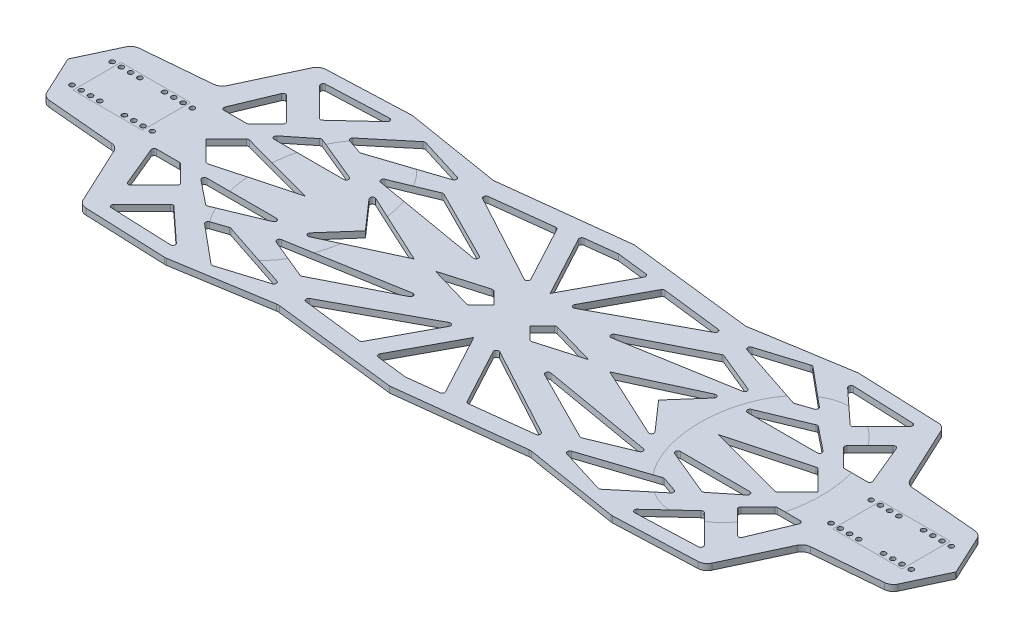
from build123d import *

# Parameters (mm, degrees)
SKETCH2_W                    = 914.4
SKETCH2_H                    = 304.8
BOSS_EXTRUDE1_DEPTH          = 6.35
CUT_EXTRUDE2_DEPTH           = 482.972947892
FILLET1_R                    = 10
FILLET1_OF_MIRROR1_R         = 10
MIRROR2_DEPTH                = 6.35
F_10_0_1935_DIAMETER_HOLE1_D = 4.9149
LPATTERN1_COUNT              = 4
LPATTERN1_PITCH              = 9.525
MIRROR3_COPY_1_D             = 4.9149
MIRROR3_COPY_2_D             = 4.9149
MIRROR3_COPY_3_D             = 4.9149
CUT_EXTRUDE3_DEPTH           = 475.544857411
FILLET3_R                    = 2.54
FILLET3_OF_MIRROR4_R         = 2.54
MIRROR5_DEPTH                = 6.35


# Read off the part's stored shape, not the designer's step: Mirror2, Mirror5
with BuildPart() as part:
    # Sketch2 → Boss-Extrude1 (new body)
    with BuildSketch(Plane(origin=(0, 0, 0), x_dir=(1, 0, 0), z_dir=(0, 1, 0))):
        Rectangle(SKETCH2_W, SKETCH2_H)
    extrude(amount=BOSS_EXTRUDE1_DEPTH)

    # Sketch3 → Cut-Extrude2 (cut, through all)
    with BuildSketch(Plane(origin=(0, 6.35, 0), x_dir=(1, 0, 0), z_dir=(0, 1, 0))):
        Polygon((-457.2, 0), (-435.81651097, 45.85704021), (-353.96964896, 53.017712781), (-321.201226945, 123.289820567), (-229.656082524, 127), (-129.870521739, 110.741205892), (9.693861985, 127), (9.693861985, 240.470811704), (-689.383609758, 240.470811704), (-689.383609758, 0), align=None)
    cut_extrude2 = extrude(amount=-CUT_EXTRUDE2_DEPTH, mode=Mode.SUBTRACT)

    # Fillet1
    fillet1_edges = [part.edges().sort_by_distance(p)[0] for p in [
        (-129.870521739, 3.175, -110.741205892),
        (-229.656082524, 3.175, -127),
        (-321.201226945, 3.175, -123.289820567),
        (-353.96964896, 3.175, -53.017712781),
        (-435.81651097, 3.175, -45.85704021),
    ]]
    fillet(fillet1_edges, radius=FILLET1_R)

    # Mirror1: Cut-Extrude2 across plane
    add(cut_extrude2.mirror(Plane.XY), mode=Mode.SUBTRACT)

    # Fillet1 of Mirror1
    fillet1_of_mirror1_edges = [part.edges().sort_by_distance(p)[0] for p in [
        (-129.870521739, 3.175, 110.741205892),
        (-229.656082524, 3.175, 127),
        (-321.201226945, 3.175, 123.289820567),
        (-353.96964896, 3.175, 53.017712781),
        (-435.81651097, 3.175, 45.85704021),
    ]]
    fillet(fillet1_of_mirror1_edges, radius=FILLET1_OF_MIRROR1_R)

    # Mirror2 outline → Mirror2 (cut)
    with BuildSketch(Plane(origin=(0, 0, 0), x_dir=(1, 0, 0), z_dir=(0, 1, 0))):
        with BuildLine():
            ThreePointArc((131.248778042, -110.965775311), (129.868312354, -110.838211083), (128.483470362, -110.902792839))
            Line((128.483470362, -110.902792839), (0, -125.870696793))
            Line((0, -125.870696793), (9.693861985, -127))
            Line((9.693861985, -127), (9.693861985, -152.4))
            Line((9.693861985, -152.4), (457.2, -152.4))
            Line((457.2, -152.4), (457.2, 0))
            Line((457.2, 0), (438.256498642, -40.624469761))
            ThreePointArc((438.256498642, -40.624469761), (434.929185135, -44.589807587), (430.064978199, -46.360234125))
            Line((430.064978199, -46.360234125), (359.721181731, -52.514518865))
            ThreePointArc((359.721181731, -52.514518865), (354.856974795, -54.284945403), (351.529661288, -58.250283229))
            Line((351.529661288, -58.250283229), (323.774786794, -117.77080366))
            ThreePointArc((323.774786794, -117.77080366), (320.254404498, -121.867993302), (315.116660614, -123.536418384))
            Line((315.116660614, -123.536418384), (230.668821834, -126.958955283))
            ThreePointArc((230.668821834, -126.958955283), (229.659180652, -126.948858729), (228.655704142, -126.837001005))
            Line((228.655704142, -126.837001005), (131.248778042, -110.965775311))
        make_face()
        with BuildLine():
            Line((438.256498642, 40.624469761), (457.2, 0))
            Line((457.2, 0), (457.2, 152.4))
            Line((457.2, 152.4), (9.693861985, 152.4))
            Line((9.693861985, 152.4), (9.693861985, 127))
            Line((9.693861985, 127), (0, 125.870696793))
            Line((0, 125.870696793), (128.483470362, 110.902792839))
            ThreePointArc((128.483470362, 110.902792839), (129.868312354, 110.838211083), (131.248778042, 110.965775311))
            Line((131.248778042, 110.965775311), (228.655704142, 126.837001005))
            ThreePointArc((228.655704142, 126.837001005), (229.659180652, 126.948858729), (230.668821834, 126.958955283))
            Line((230.668821834, 126.958955283), (315.116660614, 123.536418384))
            ThreePointArc((315.116660614, 123.536418384), (320.254404498, 121.867993302), (323.774786794, 117.77080366))
            Line((323.774786794, 117.77080366), (351.529661288, 58.250283229))
            ThreePointArc((351.529661288, 58.250283229), (354.856974795, 54.284945403), (359.721181731, 52.514518865))
            Line((359.721181731, 52.514518865), (430.064978199, 46.360234125))
            ThreePointArc((430.064978199, 46.360234125), (434.929185135, 44.589807587), (438.256498642, 40.624469761))
        make_face()
    extrude(amount=MIRROR2_DEPTH, mode=Mode.SUBTRACT)

    # #10 (0.1935) Diameter Hole1 (through all)
    with Locations(Plane(origin=(0, 6.35, 0), x_dir=(1, 0, 0), z_dir=(0, 1, 0))):
        with Locations((-431.94774624, 20.287648179), (-431.94774624, -20.987351821), (-377.97274624, 20.287648179), (-377.97274624, -20.987351821)):
            f_10_0_1935_diameter_hole1 = Hole(F_10_0_1935_DIAMETER_HOLE1_D / 2)

    # LPattern1: #10 (0.1935) Diameter Hole1 ×4
    with Locations(*[(i * LPATTERN1_PITCH, 0, 0) for i in range(1, LPATTERN1_COUNT)]):
        add(f_10_0_1935_diameter_hole1, mode=Mode.SUBTRACT)

    # Mirror3: #10 (0.1935) Diameter Hole1 across plane
    add(f_10_0_1935_diameter_hole1.mirror(Plane(origin=(0, 0, 0), x_dir=(0, 0, 1), z_dir=(1, 0, 0))), mode=Mode.SUBTRACT)

    # Mirror3 copy 1 (through all)
    with Locations(Plane(origin=(-9.525, 6.35, 0), x_dir=(-1, 0, 0), z_dir=(0, 1, 0))):
        with Locations((-431.94774624, -20.287648179), (-431.94774624, 20.987351821), (-377.97274624, -20.287648179), (-377.97274624, 20.987351821)):
            Hole(MIRROR3_COPY_1_D / 2)

    # Mirror3 copy 2 (through all)
    with Locations(Plane(origin=(-19.05, 6.35, 0), x_dir=(-1, 0, 0), z_dir=(0, 1, 0))):
        with Locations((-431.94774624, -20.287648179), (-431.94774624, 20.987351821), (-377.97274624, -20.287648179), (-377.97274624, 20.987351821)):
            Hole(MIRROR3_COPY_2_D / 2)

    # Mirror3 copy 3 (through all)
    with Locations(Plane(origin=(-28.575, 6.35, 0), x_dir=(-1, 0, 0), z_dir=(0, 1, 0))):
        with Locations((-431.94774624, -20.287648179), (-431.94774624, 20.987351821), (-377.97274624, -20.287648179), (-377.97274624, 20.987351821)):
            Hole(MIRROR3_COPY_3_D / 2)

    # Sketch7 → Cut-Extrude3 (cut, through all)
    with BuildSketch(Plane(origin=(0, 6.35, 0), x_dir=(1, 0, 0), z_dir=(0, 1, 0))):
        Polygon((0, 39.271959158), (-35.591033223, 105.521627367), (0, 109.754625554), align=None)
        Polygon((-18.585679263, 34.595654386), (-54.470165163, 101.391559684), (-126.338263443, 92.843970526), align=None)
        Polygon((-54.470165163, 28.387295362), (-144.061418156, 73.622483219), (-195.040772922, 52.57839898), align=None)
        Polygon((-144.061418156, 92.843970526), (-199.648602182, 110.032270073), (-243.422980158, 73.622483219), (-223.263727143, 66.689876091), align=None)
        Polygon((-307.932589807, 110.032270073), (-232.022190471, 113.108798099), (-273.222686167, 74.999330314), align=None)
        Polygon((-255.518531967, 59.634137535), (-195.040772922, 34.595654386), (-286.765374141, 34.595654386), align=None)
        Polygon((-314.988328362, 82.817278503), (-286.765374141, 54.594324281), (-306.764044036, 34.595654386), (-334.986998258, 34.595654386), align=None)
        Polygon((-314.988328362, 0), (-293.234960801, 21.753367562), (-212.176137985, 0), align=None)
        Polygon((-185.447760823, 39.271959158), (-150.876982287, 0), (-100.678317564, 0), align=None)
        Polygon((-18.585679263, 0), (-32.154754454, 13.56907519), (-78.893991363, 0), align=None)
    cut_extrude3 = extrude(amount=-CUT_EXTRUDE3_DEPTH, mode=Mode.SUBTRACT)

    # Fillet3
    fillet3_edges = [part.edges().sort_by_distance(p)[0] for p in [
        (-286.765374141, 3.175, -34.595654386),
        (-255.518531967, 3.175, -59.634137535),
        (-195.040772922, 3.175, -34.595654386),
        (-273.222686167, 3.175, -74.999330314),
        (-307.932589807, 3.175, -110.032270073),
        (-232.022190471, 3.175, -113.108798099),
        (-334.986998258, 3.175, -34.595654386),
        (-314.988328362, 3.175, -82.817278503),
        (-286.765374141, 3.175, -54.594324281),
        (-306.764044036, 3.175, -34.595654386),
        (-293.234960801, 3.175, -21.753367562),
        (-18.585679263, 3.175, -34.595654386),
        (-126.338263443, 3.175, -92.843970526),
        (-54.470165163, 3.175, -101.391559684),
        (-35.591033223, 3.175, -105.521627367),
        (-144.061418156, 3.175, -92.843970526),
        (-223.263727143, 3.175, -66.689876091),
        (-243.422980158, 3.175, -73.622483219),
        (-199.648602182, 3.175, -110.032270073),
        (-54.470165163, 3.175, -28.387295362),
        (-195.040772922, 3.175, -52.57839898),
        (-144.061418156, 3.175, -73.622483219),
        (-185.447760823, 3.175, -39.271959158),
        (-32.154754454, 3.175, -13.56907519),
    ]]
    fillet(fillet3_edges, radius=FILLET3_R)

    # Mirror4: Cut-Extrude3 across plane
    add(cut_extrude3.mirror(Plane.XY), mode=Mode.SUBTRACT)

    # Fillet3 of Mirror4
    fillet3_of_mirror4_edges = [part.edges().sort_by_distance(p)[0] for p in [
        (-286.765374141, 3.175, 34.595654386),
        (-255.518531967, 3.175, 59.634137535),
        (-195.040772922, 3.175, 34.595654386),
        (-273.222686167, 3.175, 74.999330314),
        (-307.932589807, 3.175, 110.032270073),
        (-232.022190471, 3.175, 113.108798099),
        (-334.986998258, 3.175, 34.595654386),
        (-314.988328362, 3.175, 82.817278503),
        (-286.765374141, 3.175, 54.594324281),
        (-306.764044036, 3.175, 34.595654386),
        (-293.234960801, 3.175, 21.753367562),
        (-18.585679263, 3.175, 34.595654386),
        (-126.338263443, 3.175, 92.843970526),
        (-54.470165163, 3.175, 101.391559684),
        (-35.591033223, 3.175, 105.521627367),
        (-144.061418156, 3.175, 92.843970526),
        (-223.263727143, 3.175, 66.689876091),
        (-243.422980158, 3.175, 73.622483219),
        (-199.648602182, 3.175, 110.032270073),
        (-54.470165163, 3.175, 28.387295362),
        (-195.040772922, 3.175, 52.57839898),
        (-144.061418156, 3.175, 73.622483219),
        (-185.447760823, 3.175, 39.271959158),
        (-32.154754454, 3.175, 13.56907519),
    ]]
    fillet(fillet3_of_mirror4_edges, radius=FILLET3_OF_MIRROR4_R)

    # Mirror5 outline → Mirror5 (cut)
    with BuildSketch(Plane(origin=(0, 0, 0), x_dir=(1, 0, 0), z_dir=(0, 1, 0))):
        with BuildLine():
            Line((307.816146485, 34.595654386), (331.183826326, 34.595654386))
            ThreePointArc((331.183826326, 34.595654386), (333.296066507, 35.724966109), (333.530056612, 38.108692641))
            Line((333.530056612, 38.108692641), (316.443896484, 79.307552145))
            ThreePointArc((316.443896484, 79.307552145), (314.592652902, 80.825816394), (312.301614974, 80.130565114))
            Line((312.301614974, 80.130565114), (288.561425365, 56.390375506))
            ThreePointArc((288.561425365, 56.390375506), (287.817476589, 54.594324282), (288.561425365, 52.798273057))
            Line((288.561425365, 52.798273057), (306.02009526, 35.339603162))
            ThreePointArc((306.02009526, 35.339603162), (306.844130566, 34.789000373), (307.816146485, 34.595654386))
        make_face()
        with BuildLine():
            Line((207.815975344, 34.595654386), (279.533649808, 34.595654386))
            ThreePointArc((279.533649808, 34.595654386), (281.930129348, 36.293938393), (281.121960955, 39.117791541))
            Line((281.121960955, 39.117791541), (256.690665259, 58.694892555))
            ThreePointArc((256.690665259, 58.694892555), (255.46058375, 59.227367006), (254.130743118, 59.059577098))
            Line((254.130743118, 59.059577098), (206.844364351, 39.482476083))
            ThreePointArc((206.844364351, 39.482476083), (205.32473799, 36.640339895), (207.815975344, 34.595654386))
        make_face()
        with BuildLine():
            ThreePointArc((333.530056612, -38.108692641), (333.296066507, -35.724966109), (331.183826326, -34.595654386))
            Line((331.183826326, -34.595654386), (307.816146485, -34.595654386))
            ThreePointArc((307.816146485, -34.595654386), (306.844130566, -34.789000373), (306.02009526, -35.339603162))
            Line((306.02009526, -35.339603162), (288.561425365, -52.798273057))
            ThreePointArc((288.561425365, -52.798273057), (287.817476589, -54.594324282), (288.561425365, -56.390375506))
            Line((288.561425365, -56.390375506), (312.301614974, -80.130565114))
            ThreePointArc((312.301614974, -80.130565114), (314.592652902, -80.825816394), (316.443896484, -79.307552145))
            Line((316.443896484, -79.307552145), (333.530056612, -38.108692641))
        make_face()
        with BuildLine():
            ThreePointArc((281.121960955, -39.117791541), (281.930129348, -36.293938393), (279.533649808, -34.595654386))
            Line((279.533649808, -34.595654386), (207.815975344, -34.595654386))
            ThreePointArc((207.815975344, -34.595654386), (205.32473799, -36.640339895), (206.844364351, -39.482476083))
            Line((206.844364351, -39.482476083), (254.130743118, -59.059577098))
            ThreePointArc((254.130743118, -59.059577098), (255.46058375, -59.227367006), (256.690665259, -58.694892555))
            Line((256.690665259, -58.694892555), (281.121960955, -39.117791541))
        make_face()
        with BuildLine():
            ThreePointArc((31.889203171, -105.961902303), (33.842522319, -104.611961275), (33.826773749, -102.237609056))
            Line((33.826773749, -102.237609056), (0, -39.271959158))
            Line((0, -39.271959158), (0, -109.754625554))
            Line((0, -109.754625554), (31.889203171, -105.961902303))
        make_face()
        with BuildLine():
            ThreePointArc((31.092810158, -12.507130894), (32.256948097, -13.171219016), (33.597020953, -13.150364405))
            Line((33.597020953, -13.150364405), (78.893991363, 0))
            Line((78.893991363, 0), (33.597020953, 13.150364405))
            ThreePointArc((33.597020953, 13.150364405), (32.256948097, 13.171219016), (31.092810158, 12.507130894))
            Line((31.092810158, 12.507130894), (18.585679263, 0))
            Line((18.585679263, 0), (31.092810158, -12.507130894))
        make_face()
        with BuildLine():
            Line((174.504360325, 34.202104256), (100.678317564, 0))
            Line((100.678317564, 0), (174.504360325, -34.202104256))
            ThreePointArc((174.504360325, -34.202104256), (177.607258096, -33.417163566), (177.478611741, -30.219108441))
            Line((177.478611741, -30.219108441), (150.876982287, 0))
            Line((150.876982287, 0), (177.478611741, 30.219108441))
            ThreePointArc((177.478611741, 30.219108441), (177.607258096, 33.417163566), (174.504360325, 34.202104256))
        make_face()
        with BuildLine():
            ThreePointArc((186.905239757, -55.936716205), (188.460564465, -53.308705144), (186.366846676, -51.085684024))
            Line((186.366846676, -51.085684024), (71.194543655, -31.265430268))
            ThreePointArc((71.194543655, -31.265430268), (68.351901299, -32.972060722), (69.618948546, -36.036011495))
            Line((69.618948546, -36.036011495), (143.022849278, -73.098103252))
            ThreePointArc((143.022849278, -73.098103252), (144.071069096, -73.36888805), (145.136837468, -73.178554207))
            Line((145.136837468, -73.178554207), (186.905239757, -55.936716205))
        make_face()
        with BuildLine():
            ThreePointArc((224.073279812, -66.968274829), (223.262865289, -66.830261734), (222.450817338, -66.958314222))
            Line((222.450817338, -66.958314222), (151.606052482, -90.352590146))
            ThreePointArc((151.606052482, -90.352590146), (149.862622488, -92.788691897), (151.652158043, -95.191128657))
            Line((151.652158043, -95.191128657), (198.332836228, -109.625417671))
            ThreePointArc((198.332836228, -109.625417671), (199.580237132, -109.689670123), (200.707440094, -109.151570805))
            Line((200.707440094, -109.151570805), (239.952378984, -76.509191263))
            ThreePointArc((239.952378984, -76.509191263), (240.826497164, -74.098433311), (239.154132031, -72.154460226))
            Line((239.154132031, -72.154460226), (224.073279812, -66.968274829))
        make_face()
        with BuildLine():
            ThreePointArc((118.381692832, -93.790280479), (120.576673621, -91.744265568), (119.289585926, -89.033634101))
            Line((119.289585926, -89.033634101), (26.04294244, -38.626861863))
            ThreePointArc((26.04294244, -38.626861863), (23.041350984, -39.062904292), (22.597520437, -42.063354045))
            Line((22.597520437, -42.063354045), (53.651140996, -99.867016158))
            ThreePointArc((53.651140996, -99.867016158), (54.716408047, -100.918244946), (56.188669905, -101.187170354))
            Line((56.188669905, -101.187170354), (118.381692832, -93.790280479))
        make_face()
        with BuildLine():
            ThreePointArc((291.81797247, -21.373097198), (293.133249255, -21.373480047), (294.272376214, -20.715952148))
            Line((294.272376214, -20.715952148), (314.988328362, 0))
            Line((314.988328362, 0), (294.272376214, 20.715952148))
            ThreePointArc((294.272376214, 20.715952148), (293.133249255, 21.373480047), (291.81797247, 21.373097198))
            Line((291.81797247, 21.373097198), (212.176137985, 0))
            Line((212.176137985, 0), (291.81797247, -21.373097198))
        make_face()
        with BuildLine():
            ThreePointArc((302.176487965, -110.265555747), (304.437341086, -108.657408557), (303.877981086, -105.939926155))
            Line((303.877981086, -105.939926155), (274.950069826, -76.742790287))
            ThreePointArc((274.950069826, -76.742790287), (273.201068924, -75.991106499), (271.420976506, -76.665868426))
            Line((271.420976506, -76.665868426), (237.083679123, -108.427042807))
            ThreePointArc((237.083679123, -108.427042807), (236.462522543, -111.265514297), (238.911279322, -112.82959426))
            Line((238.911279322, -112.82959426), (302.176487965, -110.265555747))
        make_face()
        with BuildLine():
            Line((31.889203171, 105.961902303), (0, 109.754625554))
            Line((0, 109.754625554), (0, 39.271959158))
            Line((0, 39.271959158), (33.826773749, 102.237609056))
            ThreePointArc((33.826773749, 102.237609056), (33.842522319, 104.611961275), (31.889203171, 105.961902303))
        make_face()
        with BuildLine():
            Line((71.194543655, 31.265430268), (186.366846676, 51.085684024))
            ThreePointArc((186.366846676, 51.085684024), (188.460564465, 53.308705144), (186.905239757, 55.936716205))
            Line((186.905239757, 55.936716205), (145.136837468, 73.178554207))
            ThreePointArc((145.136837468, 73.178554207), (144.071069096, 73.36888805), (143.022849278, 73.098103252))
            Line((143.022849278, 73.098103252), (69.618948546, 36.036011495))
            ThreePointArc((69.618948546, 36.036011495), (68.351901299, 32.972060722), (71.194543655, 31.265430268))
        make_face()
        with BuildLine():
            Line((151.606052482, 90.352590146), (222.450817338, 66.958314222))
            ThreePointArc((222.450817338, 66.958314222), (223.262865289, 66.830261734), (224.073279812, 66.968274829))
            Line((224.073279812, 66.968274829), (239.154132031, 72.154460226))
            ThreePointArc((239.154132031, 72.154460226), (240.826497164, 74.098433311), (239.952378984, 76.509191263))
            Line((239.952378984, 76.509191263), (200.707440094, 109.151570805))
            ThreePointArc((200.707440094, 109.151570805), (199.580237132, 109.689670123), (198.332836228, 109.625417671))
            Line((198.332836228, 109.625417671), (151.652158043, 95.191128657))
            ThreePointArc((151.652158043, 95.191128657), (149.862622488, 92.788691897), (151.606052482, 90.352590146))
        make_face()
        with BuildLine():
            Line((26.04294244, 38.626861863), (119.289585926, 89.033634101))
            ThreePointArc((119.289585926, 89.033634101), (120.576673621, 91.744265568), (118.381692832, 93.790280479))
            Line((118.381692832, 93.790280479), (56.188669905, 101.187170354))
            ThreePointArc((56.188669905, 101.187170354), (54.716408047, 100.918244946), (53.651140996, 99.867016158))
            Line((53.651140996, 99.867016158), (22.597520437, 42.063354045))
            ThreePointArc((22.597520437, 42.063354045), (23.041350984, 39.062904292), (26.04294244, 38.626861863))
        make_face()
        with BuildLine():
            Line((274.950069826, 76.742790287), (303.877981086, 105.939926155))
            ThreePointArc((303.877981086, 105.939926155), (304.437341086, 108.657408557), (302.176487965, 110.265555747))
            Line((302.176487965, 110.265555747), (238.911279322, 112.82959426))
            ThreePointArc((238.911279322, 112.82959426), (236.462522543, 111.265514297), (237.083679123, 108.427042807))
            Line((237.083679123, 108.427042807), (271.420976506, 76.665868426))
            ThreePointArc((271.420976506, 76.665868426), (273.201068924, 75.991106499), (274.950069826, 76.742790287))
        make_face()
    extrude(amount=MIRROR5_DEPTH, mode=Mode.SUBTRACT)


solid = part.part
